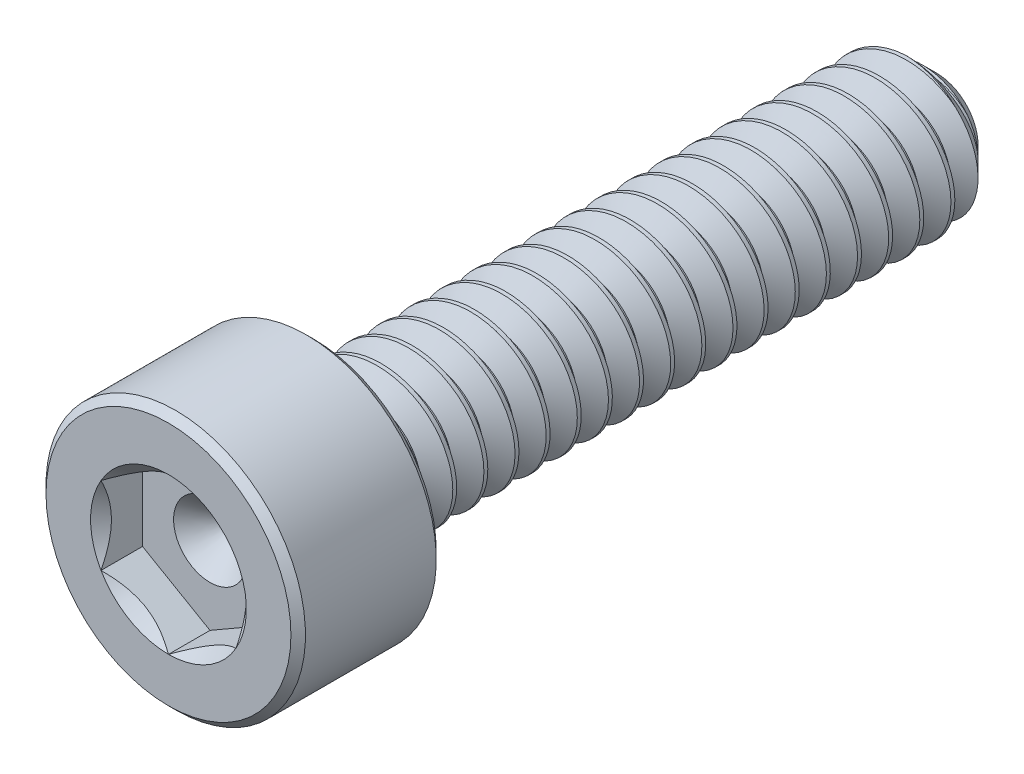
from build123d import *

# Parameters (mm, degrees)
CUT_EXTRUDE1_DEPTH = 0.4
SKETCH4_R          = 0.75055535
CUT_EXTRUDE2_DEPTH = 0.7
CUT_EXTRUDE2_DRAFT = -45
CUT_SWEEP1_PITCH   = 0.3
CUT_SWEEP1_TO      = 6


with BuildPart() as part:
    # Sketch2 → Revolve1 (revolve)
    with BuildSketch(Plane(origin=(0, 0, 0), x_dir=(0, 0, -1), z_dir=(1, 0, 0))):
        Polygon((-3.7, 0), (-3.7, 1.18), (-3.63, 1.25), (-2.37, 1.25), (-2.3, 1.18), (-2.3, 0.7), (3.4, 0.7), (3.7, 0.4), (3.7, 0), align=None)
    revolve(axis=Axis((0, 0, -3.7), (0, 0, 1)))

    # Sketch3 → Cut-Extrude1 (cut)
    with BuildSketch(Plane.XY.offset(3.7)):
        Polygon((0.65, -0.375277675), (0.65, 0.375277675), (0, 0.75055535), (-0.65, 0.375277675), (-0.65, -0.375277675), (0, -0.75055535), align=None)
    extrude(amount=-CUT_EXTRUDE1_DEPTH, mode=Mode.SUBTRACT)


with BuildPart() as cut_extrude2_tool:
    # Sketch4 → Cut-Extrude2 (with draft: the straight prism first)
    with BuildSketch(Plane.XY.offset(3.7)):
        Circle(SKETCH4_R)
    extrude(amount=-CUT_EXTRUDE2_DEPTH)
    # Cut-Extrude2: the draft: its side faces are tilted about the plane it starts from
    cut_extrude2_sides = [cut_extrude2_tool.faces().sort_by_distance(p)[0] for p in [
        (-0.75055535, 0, 3.35),
    ]]
    draft(cut_extrude2_sides, Plane.XY.offset(3.7), CUT_EXTRUDE2_DRAFT)


with BuildPart() as part_1:
    add(part.part)

    # Cut-Extrude2: cut by cut_extrude2_tool
    add(cut_extrude2_tool.part, mode=Mode.SUBTRACT)


with BuildPart() as body_2:
    # Split1: read off the stored shape, not the designer's step
    # Split1: the piece on the far side of the plane
    add(part_1.part)
    split(bisect_by=Plane.XY.offset(2.3), keep=Keep.BOTTOM)

    # Cut-Sweep1: arcs per turn and ends read off the stored shape
    # Cut-Sweep1: the profile of Sketch7 screwed along a right-hand helix through 21.15 turns, 6 arcs to a turn; built about Z, then put on its axis
    cut_sweep1_z = Axis((0, 0, 0), (0, 0, 1))
    cut_sweep1_corners = [(0.716237976, 0, 0.009375), (0.716237976, 0, -0.271875), (0.505144284, 0, -0.15), (0.505144284, 0, -0.1125)]
    with BuildLine(mode=Mode.PRIVATE) as cut_sweep1_profile:
        Line(cut_sweep1_corners[0], cut_sweep1_corners[1])
        Line(cut_sweep1_corners[1], cut_sweep1_corners[2])
        Line(cut_sweep1_corners[2], cut_sweep1_corners[3])
        Line(cut_sweep1_corners[3], cut_sweep1_corners[0])
    cut_sweep1_cap = Face(cut_sweep1_profile.wire())
    cut_sweep1_turn_angles = [0, 30, 60, 90, 120, 150, 180, 210, 240, 270, 300, 330, 360]
    cut_sweep1_turn_weights = [1, 0.8660254037844387, 1, 0.8660254037844387, 1, 0.8660254037844387, 1, 0.8660254037844387, 1, 0.8660254037844387, 1, 0.8660254037844387, 1]
    cut_sweep1_turn_rails = [Edge.make_bspline([Vector(p[0], p[1], 0).rotate(cut_sweep1_z, cut_sweep1_turn_angles[k]) / cut_sweep1_turn_weights[k] + Vector(0, 0, p[2] + CUT_SWEEP1_PITCH * cut_sweep1_turn_angles[k] / 360) for k in range(13)], [0, 0, 0, 1, 1, 2, 2, 3, 3, 4, 4, 5, 5, 6, 6, 6], 2, cut_sweep1_turn_weights) for p in cut_sweep1_corners]
    cut_sweep1_turn_sides = [Face.make_surface_from_curves(cut_sweep1_turn_rails[p[0]], cut_sweep1_turn_rails[p[1]]) for p in [(0, 1), (1, 2), (2, 3), (3, 0)]]
    cut_sweep1_last_angles = [7560, 7587, 7614]
    cut_sweep1_last_weights = [1, 0.8910065241884615, 1]
    cut_sweep1_last_rails = [Edge.make_bspline([Vector(p[0], p[1], 0).rotate(cut_sweep1_z, cut_sweep1_last_angles[k]) / cut_sweep1_last_weights[k] + Vector(0, 0, p[2] + CUT_SWEEP1_PITCH * cut_sweep1_last_angles[k] / 360) for k in range(3)], [0, 0, 0, 1, 1, 1], 2, cut_sweep1_last_weights) for p in cut_sweep1_corners]
    cut_sweep1_last_sides = [Face.make_surface_from_curves(cut_sweep1_last_rails[p[0]], cut_sweep1_last_rails[p[1]]) for p in [(0, 1), (1, 2), (2, 3), (3, 0)]]
    cut_sweep1 = Plane(origin=(0, 0, -3.7), x_dir=(0, 1, 0), z_dir=(0, 0, 1)) * split(Solid(Shell([*[p.moved(Location((0, 0, CUT_SWEEP1_PITCH * i))) for i in range(21) for p in cut_sweep1_turn_sides], *cut_sweep1_last_sides, cut_sweep1_cap, cut_sweep1_cap.rotate(cut_sweep1_z, 7614).moved(Location((0, 0, CUT_SWEEP1_PITCH * 7614 / 360)))])), bisect_by=Plane.XY.offset(CUT_SWEEP1_TO), keep=Keep.BOTTOM, mode=Mode.PRIVATE)
    add(cut_sweep1, mode=Mode.SUBTRACT)


with BuildPart() as part_2:
    add(part_1.part)

    # Split1
    split(bisect_by=Plane.XY.offset(2.3), keep=Keep.TOP)

    add(body_2.part)  # Boss-Extrude1 merges body 2
    # Boss-Extrude1: read off the stored shape, not the designer's step
    # Boss-Extrude1 outline → Boss-Extrude1 (revolve)
    with BuildSketch(Plane.XZ):
        Polygon((0.505141783, 2.3), (0.505141783, 2.105141783), (0.7, 2.3), align=None)
    revolve(axis=Axis((0, 0, 0), (0, 0, 1)))


solid = part_2.part
